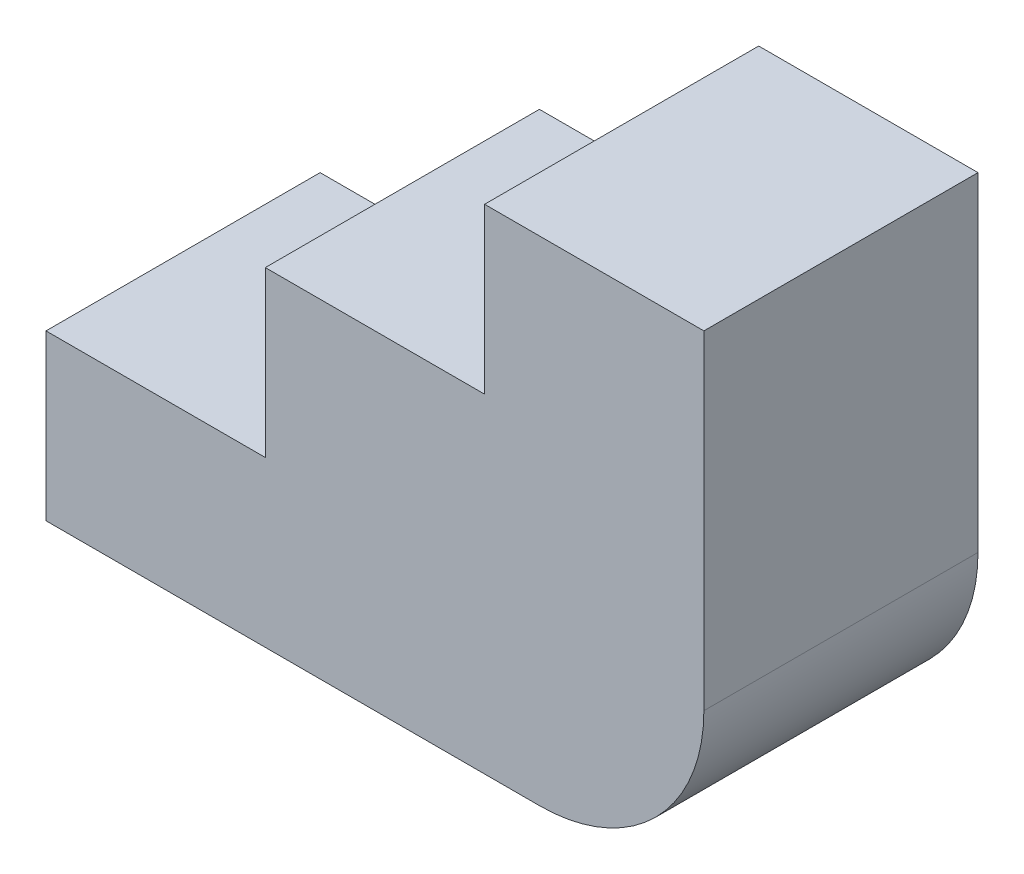
from build123d import *

# Parameters (mm, degrees)
RESSALTO_EXTRUS_O1_DEPTH = 25


with BuildPart() as part:
    # Esboço1 → Ressalto-extrusão1 (new body)
    with BuildSketch(Plane.XY):
        with BuildLine():
            Line((0, 0), (0, -15))
            Line((0, -15), (45, -15))
            ThreePointArc((45, -15), (55.606601718, -10.606601718), (60, 0))
            Line((60, 0), (60, 30))
            Line((60, 30), (40, 30))
            Line((40, 30), (40, 15))
            Line((40, 15), (20, 15))
            Line((20, 15), (20, 0))
            Line((20, 0), (0, 0))
        make_face()
    extrude(amount=RESSALTO_EXTRUS_O1_DEPTH)


solid = part.part
